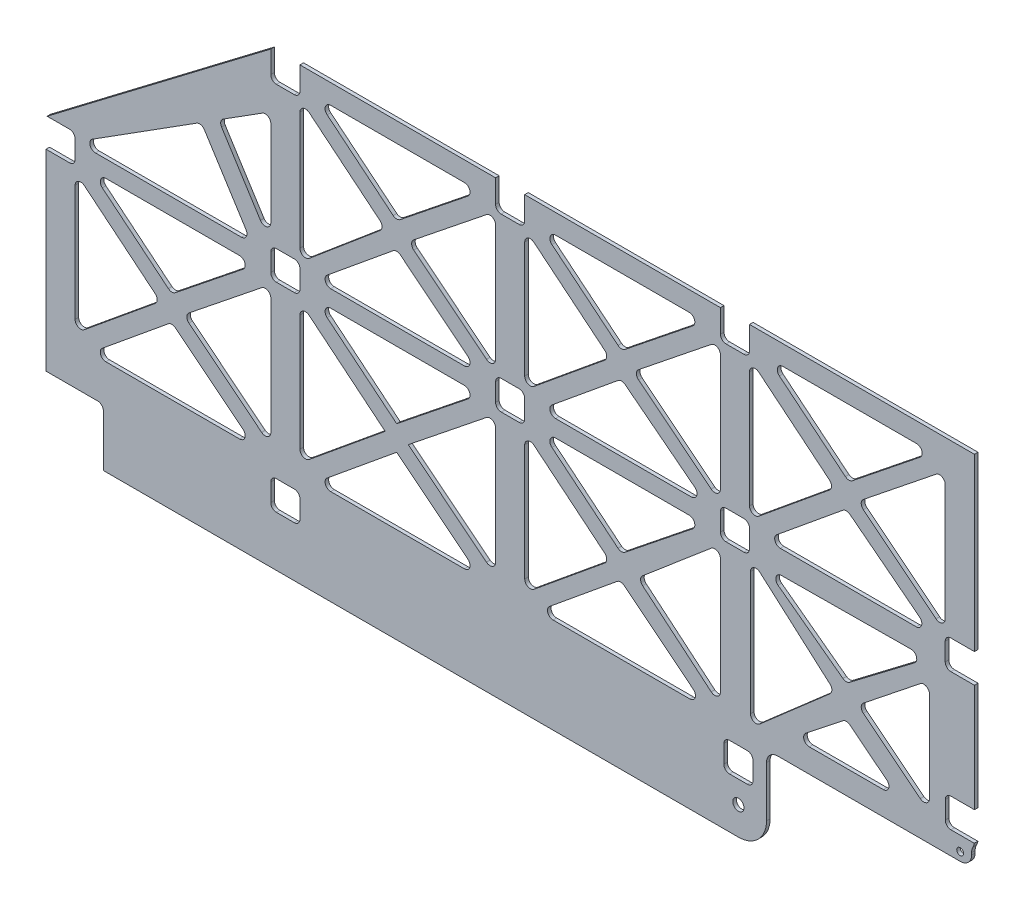
from build123d import *

# Parameters (mm, degrees)
CROQUIS1_W            = 1652
CROQUIS1_H            = 800
BRIDA_BASE1_DEPTH     = 6.35
CROQUIS14_W           = 51.8
CROQUIS14_H           = 51.8
CROQUIS14_W_2         = 63.126519035
CORTAR_EXTRUIR1_DEPTH = 1219.164820759
REDONDEO1_R           = 10
REDONDEO2_R           = 10
CORTAR_EXTRUIR2_DEPTH = 10
CROQUIS19_W           = 370
CROQUIS19_H           = 160
CROQUIS19_W_2         = 5
CROQUIS19_H_2         = 30
CORTAR_EXTRUIR3_DEPTH = 10
REDONDEO4_R           = 50
REDONDEO5_R           = 20
REDONDEO6_R           = 50
REDONDEO7_R           = 20
CROQUIS20_R           = 10
CROQUIS20_R_2         = 6.1
CORTAR_EXTRUIR4_DEPTH = 10
CROQUIS21_W           = 51.8
CROQUIS21_H           = 51.8
CROQUIS21_W_2         = 102.1
CROQUIS21_H_2         = 102.1
CORTAR_EXTRUIR5_DEPTH = 10
REDONDEO8_R           = 10


# Sheet-metal steps are written as plain solids
with BuildPart() as part:
    # Brida base1: sheet metal written as solids
    # Croquis1 → Brida base1 (new body)
    with BuildSketch(Plane.XY):
        with Locations((191.278244715, -270.097142857)):
            Rectangle(CROQUIS1_W, CROQUIS1_H)
    extrude(amount=-BRIDA_BASE1_DEPTH)

    # Croquis14 → Cortar-Extruir1 (cut, through all)
    with BuildSketch(Plane.XY.offset(-6.35)):
        with Locations((-608.821755285, -200.097142857)):
            Rectangle(CROQUIS14_W, CROQUIS14_H)
        with Locations((996.841504233, -200.097142857)):
            Rectangle(CROQUIS14_W_2, CROQUIS14_H)
        with Locations((-208.821755285, -200.097142857)):
            Rectangle(CROQUIS14_W, CROQUIS14_H)
        with Locations((191.178244715, -200.097142857)):
            Rectangle(CROQUIS14_W, CROQUIS14_H)
        Polygon((565.278244715, 79.002857143), (589.278244715, 79.002857143), (617.078244715, 79.002857143), (617.078244715, 130.802857143), (565.278244715, 130.802857143), align=None)
        with Locations((591.178244715, -200.097142857)):
            Rectangle(CROQUIS14_W, CROQUIS14_H)
        with Locations((191.178244715, 104.902857143)):
            Rectangle(CROQUIS14_W, CROQUIS14_H)
        Polygon((-234.721755285, -174.028415053), (-234.721755285, 31.662574085), (-327.677719189, -27.178551066), align=None)
        Polygon((768.774847287, -46.398880447), (617.078244713, 78.102857143), (617.078244713, -170.900618037), align=None)
        Polygon((942.904178154, -187.700618037), (789.278244713, -68.381410785), (643.896190516, -187.700618037), align=None)
        Polygon((-581.267082492, -187.700618037), (-268.914894276, -187.700618037), (-358.268123968, -46.542277291), align=None)
        Polygon((937.219209929, -461.758104984), (937.219209929, -258.705187534), (809.821543904, -360.231646259), align=None)
        Polygon((789.278244713, -392.907404201), (694.665264869, -467.840948289), (883.891224557, -467.840948289), align=None)
        with Locations((-208.821755285, 104.902857143)):
            Rectangle(CROQUIS14_W, CROQUIS14_H)
        Polygon((-31.225152712, -46.398880447), (-182.921755286, 78.102857143), (-182.921755286, -174.028415053), align=None)
        Polygon((138.263878661, 94.902857143), (-156.103809483, 94.902857143), (-10.721755286, -24.416350109), align=None)
        Polygon((165.278244714, -170.900618037), (165.278244714, 78.102857143), (9.821543906, -46.398880447), align=None)
        Polygon((138.263878661, -187.700618037), (-10.721755286, -68.381410785), (-156.103809483, -187.700618037), align=None)
        Polygon((368.774847287, -46.398880447), (217.078244713, 78.102857143), (217.078244713, -170.900618037), align=None)
        Polygon((538.26387866, 94.902857143), (243.896190516, 94.902857143), (389.278244713, -24.416350109), align=None)
        Polygon((565.278244713, -170.900618037), (565.278244713, 78.102857143), (409.821543905, -46.398880447), align=None)
        Polygon((542.904178154, -187.700618037), (389.278244713, -68.381410785), (243.896190516, -187.700618037), align=None)
        Polygon((942.904178154, 94.902857143), (648.53649001, 94.902857143), (793.918544207, -24.416350109), align=None)
        Polygon((965.278244712, -170.900618037), (965.278244712, 78.102857143), (809.821543904, -46.398880447), align=None)
        Polygon((-31.225152712, -359.002355627), (-182.921755286, -234.500618037), (-182.921755286, -483.504093217), align=None)
        Polygon((138.263878661, -217.700618037), (-156.103809483, -217.700618037), (-10.721755286, -337.019825289), align=None)
        Polygon((165.278244714, -483.504093217), (165.278244714, -234.500618037), (9.821543906, -359.002355627), align=None)
        Polygon((138.263878661, -500.304093217), (-10.721755286, -380.984885965), (-156.103809483, -500.304093217), align=None)
        Polygon((368.774847287, -359.002355627), (217.078244713, -234.500618037), (217.078244713, -483.504093217), align=None)
        Polygon((538.26387866, -217.700618037), (243.896190516, -217.700618037), (389.278244713, -337.019825289), align=None)
        Polygon((565.278244715, -484.11906752), (565.278244715, -235.11559234), (417.752666734, -360.231646259), align=None)
        Polygon((539.381203197, -500.304093217), (387.67286708, -378.804335694), (239.633965884, -500.304093217), align=None)
        Polygon((768.774847287, -360.231646259), (618.72364689, -228.051212139), (618.72364689, -491.183447721), align=None)
        Polygon((934.66029891, -226.530425921), (643.896190516, -228.811792558), (789.278244713, -337.019825289), align=None)
        Polygon((-431.225152711, -359.002355627), (-582.921755285, -234.500618037), (-582.921755285, -483.504093217), align=None)
        Polygon((-261.736121338, -217.700618037), (-556.103809482, -217.700618037), (-410.721755285, -337.019825289), align=None)
        Polygon((-234.721755285, -483.504093217), (-234.721755285, -234.500618037), (-390.178456093, -359.002355627), align=None)
        Polygon((-261.736121338, -500.304093217), (-410.721755285, -380.984885965), (-556.103809482, -500.304093217), align=None)
    extrude(amount=CORTAR_EXTRUIR1_DEPTH, mode=Mode.SUBTRACT)

    # Redondeo1
    redondeo1_edges = [part.edges().sort_by_distance(p)[0] for p in [
        (9.821543906, -46.398880447, -3.175),
        (165.278244714, -170.900618037, -3.175),
        (165.278244714, 78.102857143, -3.175),
        (138.263878661, -217.700618037, -3.175),
        (-156.103809483, -217.700618037, -3.175),
        (165.278244714, -483.504093217, -3.175),
        (165.278244714, -234.500618037, -3.175),
        (-156.103809483, -500.304093217, -3.175),
        (138.263878661, -500.304093217, -3.175),
        (-182.921755286, -234.500618037, -3.175),
        (-182.921755286, -483.504093217, -3.175),
        (-390.178456093, -359.002355627, -3.175),
        (-234.721755285, -483.504093217, -3.175),
        (-234.721755285, -234.500618037, -3.175),
        (-410.721755285, -337.019825289, -3.175),
        (-261.736121338, -217.700618037, -3.175),
        (-556.103809482, -217.700618037, -3.175),
        (-581.267082492, -187.700618037, -3.175),
        (-556.103809482, -500.304093217, -3.175),
        (-261.736121338, -500.304093217, -3.175),
        (-410.721755285, -380.984885965, -3.175),
        (-268.914894276, -187.700618037, -3.175),
        (-358.268123968, -46.542277291, -3.175),
        (368.774847287, -359.002355627, -3.175),
        (217.078244713, -234.500618037, -3.175),
        (217.078244713, -483.504093217, -3.175),
        (389.278244713, -337.019825289, -3.175),
        (538.26387866, -217.700618037, -3.175),
        (243.896190516, -217.700618037, -3.175),
        (417.752666734, -360.231646259, -3.175),
        (565.278244715, -484.11906752, -3.175),
        (565.278244715, -235.11559234, -3.175),
        (239.633965884, -500.304093217, -3.175),
        (539.381203197, -500.304093217, -3.175),
        (387.67286708, -378.804335694, -3.175),
        (409.821543905, -46.398880447, -3.175),
        (565.278244713, -170.900618037, -3.175),
        (565.278244713, 78.102857143, -3.175),
        (389.278244713, -24.416350109, -3.175),
        (538.26387866, 94.902857143, -3.175),
        (243.896190516, 94.902857143, -3.175),
        (793.918544207, -24.416350109, -3.175),
        (942.904178154, 94.902857143, -3.175),
        (648.53649001, 94.902857143, -3.175),
        (809.821543904, -46.398880447, -3.175),
        (965.278244712, -170.900618037, -3.175),
        (965.278244712, 78.102857143, -3.175),
        (-431.225152711, -359.002355627, -3.175),
        (-582.921755285, -234.500618037, -3.175),
        (-582.921755285, -483.504093217, -3.175),
        (768.774847287, -360.231646259, -3.175),
        (618.72364689, -228.051212139, -3.175),
        (618.72364689, -491.183447721, -3.175),
        (789.278244713, -337.019825289, -3.175),
        (934.66029891, -226.530425921, -3.175),
        (643.896190516, -228.811792558, -3.175),
        (883.891224557, -467.840948289, -3.175),
        (789.278244713, -392.907404201, -3.175),
        (694.665264869, -467.840948289, -3.175),
        (368.774847287, -46.398880447, -3.175),
        (217.078244713, 78.102857143, -3.175),
        (217.078244713, -170.900618037, -3.175),
        (617.078244713, -170.900618037, -3.175),
        (768.774847287, -46.398880447, -3.175),
        (617.078244713, 78.102857143, -3.175),
        (643.896190516, -187.700618037, -3.175),
        (942.904178154, -187.700618037, -3.175),
        (789.278244713, -68.381410785, -3.175),
        (-327.677719189, -27.178551066, -3.175),
        (-234.721755285, -174.028415053, -3.175),
        (-234.721755285, 31.662574085, -3.175),
        (-10.721755286, -68.381410785, -3.175),
        (-156.103809483, -187.700618037, -3.175),
        (138.263878661, -187.700618037, -3.175),
        (243.896190516, -187.700618037, -3.175),
        (542.904178154, -187.700618037, -3.175),
        (389.278244713, -68.381410785, -3.175),
        (937.219209929, -461.758104984, -3.175),
        (937.219209929, -258.705187534, -3.175),
        (809.821543904, -360.231646259, -3.175),
        (565.278244715, -174.197142857, -3.175),
        (565.278244715, -225.997142857, -3.175),
        (617.078244715, -225.997142857, -3.175),
        (617.078244715, -174.197142857, -3.175),
        (-31.225152712, -46.398880447, -3.175),
        (-182.921755286, 78.102857143, -3.175),
        (-182.921755286, -174.028415053, -3.175),
        (-10.721755286, -24.416350109, -3.175),
        (138.263878661, 94.902857143, -3.175),
        (-156.103809483, 94.902857143, -3.175),
    ]]
    fillet(redondeo1_edges, radius=REDONDEO1_R)

    # Redondeo2
    redondeo2_edges = [part.edges().sort_by_distance(p)[0] for p in [
        (-182.921755285, -174.197142857, -3.175),
        (-234.721755285, -174.197142857, -3.175),
        (-234.721755285, -225.997142857, -3.175),
        (-182.921755285, -225.997142857, -3.175),
        (565.278244715, 79.002857143, -3.175),
        (617.078244715, 79.002857143, -3.175),
        (165.278244715, 79.002857143, -3.175),
        (217.078244715, 79.002857143, -3.175),
        (-234.721755285, 79.002857143, -3.175),
        (-182.921755285, 79.002857143, -3.175),
        (965.278244715, -174.197142857, -3.175),
        (965.278244715, -225.997142857, -3.175),
        (217.078244715, -174.197142857, -3.175),
        (165.278244715, -174.197142857, -3.175),
        (165.278244715, -225.997142857, -3.175),
        (217.078244715, -225.997142857, -3.175),
        (-582.921755285, -225.997142857, -3.175),
        (-582.921755285, -174.197142857, -3.175),
    ]]
    fillet(redondeo2_edges, radius=REDONDEO2_R)

    # Croquis15 → Cortar-Extruir2 (cut)
    with BuildSketch(Plane(origin=(0, 0, -6.35), x_dir=(-1, 0, 0), z_dir=(0, 0, -1))):
        Polygon((234.721755285, 129.902857143), (634.721755285, -174.197142857), (632.689400902, -174.197142857), (234.721755285, 128.357759723), align=None)
        Polygon((234.721755285, 159.890925727), (234.721755285, 129.902857143), (634.721755285, -174.197142857), (723.595264546, -174.197142857), (723.595264546, 159.890925727), align=None)
    extrude(amount=-CORTAR_EXTRUIR2_DEPTH, mode=Mode.SUBTRACT)

    # Croquis19 → Cortar-Extruir3 (cut)
    with BuildSketch(Plane.XY):
        with Locations((832.278244715, -590.097142857)):
            Rectangle(CROQUIS19_W, CROQUIS19_H)
        with Locations((1014.778244715, -495.097142857)):
            Rectangle(CROQUIS19_W_2, CROQUIS19_H_2)
    extrude(amount=-CORTAR_EXTRUIR3_DEPTH, mode=Mode.SUBTRACT)

    # Redondeo4
    redondeo4_edges = [part.edges().sort_by_distance(p)[0] for p in [
        (647.278244715, -670.097142857, -3.175),
    ]]
    fillet(redondeo4_edges, radius=REDONDEO4_R)

    # Redondeo5
    # the kernel refuses this fillet: 20 mm, written as the material it adds along each edge
    with BuildSketch(Plane(origin=(647.278244715, -510.097142857, 0), x_dir=(0, -1, 0), z_dir=(0, 0, -1))) as redondeo5_piece_1:
        with BuildLine():
            CenterArc((REDONDEO5_R, -REDONDEO5_R), REDONDEO5_R, 90, 90)
            Line((0, -REDONDEO5_R), (0, 0))
            Line((0, 0), (REDONDEO5_R, 0))
        make_face()
    extrude(amount=6.35)
    # the kernel refuses this fillet: 20 mm, written as the material it takes off along each edge
    with BuildSketch(Plane(origin=(1012.278244715, -510.097142857, 50), x_dir=(-1, 0, 0), z_dir=(0, 0, -1))) as redondeo5_2_piece_1:
        with BuildLine():
            CenterArc((REDONDEO5_R, REDONDEO5_R), REDONDEO5_R, 180, 90)
            Line((0, REDONDEO5_R), (0, 0))
            Line((0, 0), (REDONDEO5_R, 0))
        make_face()
    extrude(amount=106.35, mode=Mode.SUBTRACT)
    with BuildSketch(Plane(origin=(1017.278244715, -480.097142857, 33.071891388), x_dir=(-1, 0, 0), z_dir=(0, 0, -1))) as redondeo5_2_piece_2:
        with BuildLine():
            CenterArc((20, 13.228756555), REDONDEO5_R, 180, 41.409622109)
            Line((0, 13.228756555), (0, 0))
            Line((0, 0), (5, 0))
        make_face()
    extrude(amount=72.493782777, mode=Mode.SUBTRACT)

    # Redondeo6
    redondeo6_edges = [part.edges().sort_by_distance(p)[0] for p in [
        (-634.721755285, -670.097142857, -3.175),
    ]]
    fillet(redondeo6_edges, radius=REDONDEO6_R)

    # Redondeo7
    redondeo7_edges = [part.edges().sort_by_distance(p)[0] for p in [
        (1012.278244715, -480.097142857, -3.175),
    ]]
    fillet(redondeo7_edges, radius=REDONDEO7_R)

    # Croquis20 → Cortar-Extruir4 (cut)
    with BuildSketch(Plane.XY):
        with Locations((597.278244715, -620.097142857)):
            Circle(CROQUIS20_R)
        with Locations((991.878244715, -495.097142857)):
            Circle(CROQUIS20_R_2)
    extrude(amount=-CORTAR_EXTRUIR4_DEPTH, mode=Mode.SUBTRACT)

    # Croquis21 → Cortar-Extruir5 (cut)
    with BuildSketch(Plane.XY):
        with Locations((597.278244715, -554.697142857)):
            Rectangle(CROQUIS21_W, CROQUIS21_H)
        with Locations((991.378244715, -443.737142857)):
            Rectangle(CROQUIS21_W, CROQUIS21_H)
        with Locations((-208.821755285, -554.697142857)):
            Rectangle(CROQUIS21_W, CROQUIS21_H)
        with Locations((-583.671755285, -619.047142857)):
            Rectangle(CROQUIS21_W_2, CROQUIS21_H_2)
    extrude(amount=-CORTAR_EXTRUIR5_DEPTH, mode=Mode.SUBTRACT)

    # Redondeo8
    redondeo8_edges = [part.edges().sort_by_distance(p)[0] for p in [
        (571.378244715, -580.597142857, -3.175),
        (571.378244715, -528.797142857, -3.175),
        (623.178244715, -528.797142857, -3.175),
        (623.178244715, -580.597142857, -3.175),
        (965.478244715, -469.637142857, -3.175),
        (965.478244715, -417.837142857, -3.175),
        (-234.721755285, -580.597142857, -3.175),
        (-234.721755285, -528.797142857, -3.175),
        (-182.921755285, -528.797142857, -3.175),
        (-182.921755285, -580.597142857, -3.175),
        (-532.621755285, -567.997142857, -3.175),
    ]]
    fillet(redondeo8_edges, radius=REDONDEO8_R)


solid = part.part
